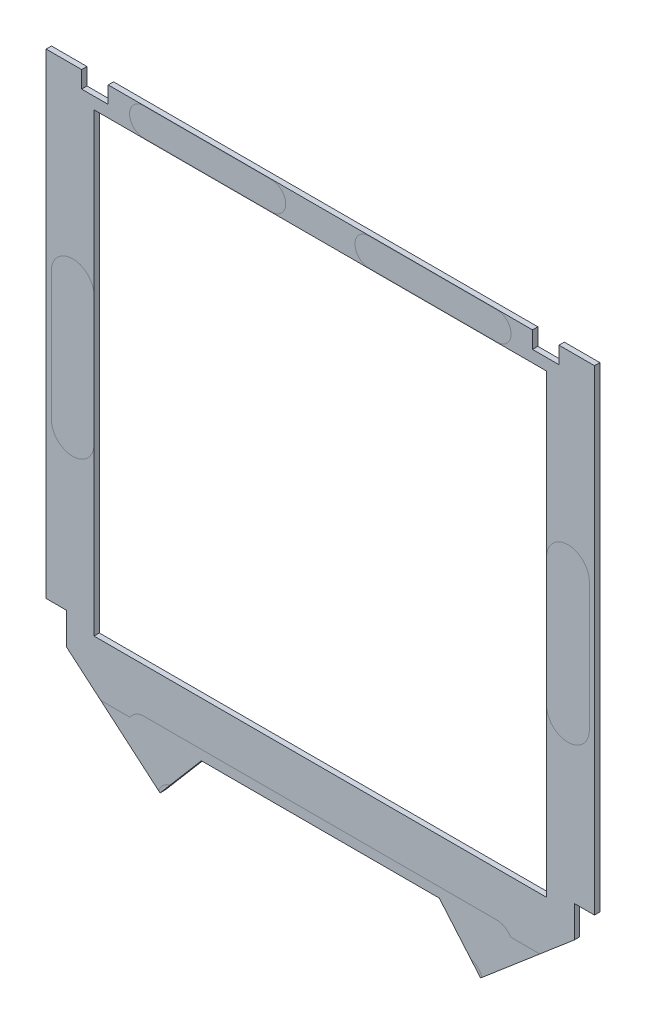
from build123d import *

# Parameters (mm, degrees)
SKETCH1_W           = 134.366
SKETCH1_H           = 135.318500012
BOSS_EXTRUDE1_DEPTH = 1.5875


with BuildPart() as part:
    # Sketch1 → Boss-Extrude1 (new body)
    with BuildSketch(Plane.XY.offset(-8.9364)):
        Polygon((-62.992, 192.0875), (62.992, 192.0875), (62.992, 187.071), (70.866, 187.071), (70.866, 192.0875), (81.407, 192.0875), (81.407, 50.8), (75.438, 50.8), (75.438, 41.429545859), (47.584469242, 17.720620478), (35.318354193, 32.131), (-35.318354193, 32.131), (-47.584469242, 17.720620478), (-75.438, 41.429545859), (-75.438, 50.8), (-81.407, 50.8), (-81.407, 192.0875), (-70.866, 192.0875), (-70.866, 187.071), (-62.992, 187.071), align=None)
        with Locations((0, 115.919250006)):
            Rectangle(SKETCH1_W, SKETCH1_H, mode=Mode.SUBTRACT)
    extrude(amount=BOSS_EXTRUDE1_DEPTH)


solid = part.part
